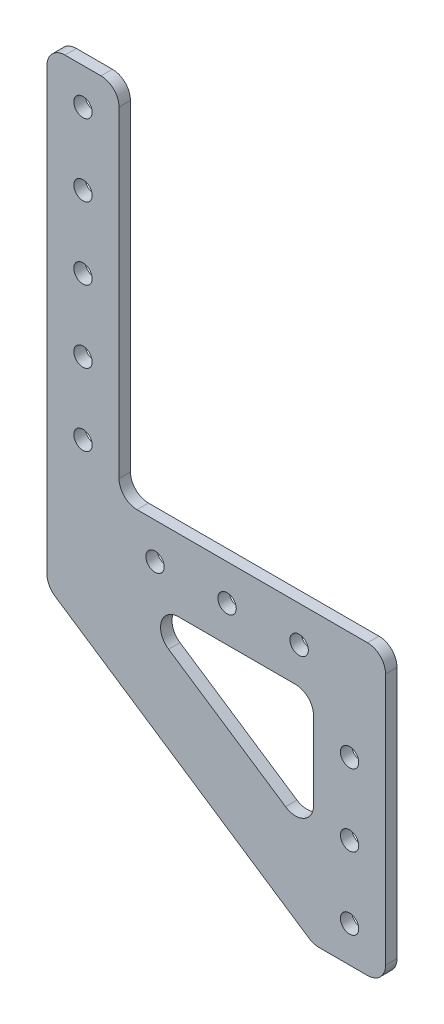
from build123d import *

# Parameters (mm, degrees)
SKETCH1_R           = 2.55
BOSS_EXTRUDE1_DEPTH = 1.5875
FILLET1_R           = 5


with BuildPart() as part:
    # Sketch1 → Boss-Extrude1 (new, symmetric)
    with BuildSketch(Plane.XY):
        Polygon((-74, 119.291259303), (-54, 119.291259303), (-54, 20), (20, 20), (20, -60), (0, -60), (-74, -10.708740697), align=None)
        with Locations((-64, 109.291259303)):
            Circle(SKETCH1_R, mode=Mode.SUBTRACT)
        with Locations((-64, 89.291259303)):
            Circle(SKETCH1_R, mode=Mode.SUBTRACT)
        with Locations((10, -50)):
            Circle(SKETCH1_R, mode=Mode.SUBTRACT)
        with Locations((10, -30)):
            Circle(SKETCH1_R, mode=Mode.SUBTRACT)
        with Locations((10, -10)):
            Circle(SKETCH1_R, mode=Mode.SUBTRACT)
        with Locations((-44, 10)):
            Circle(SKETCH1_R, mode=Mode.SUBTRACT)
        with Locations((-24, 10)):
            Circle(SKETCH1_R, mode=Mode.SUBTRACT)
        with Locations((-4, 10)):
            Circle(SKETCH1_R, mode=Mode.SUBTRACT)
        with Locations((-64, 69.291259303)):
            Circle(SKETCH1_R, mode=Mode.SUBTRACT)
        with Locations((-64, 49.291259303)):
            Circle(SKETCH1_R, mode=Mode.SUBTRACT)
        with Locations((-64, 29.291259303)):
            Circle(SKETCH1_R, mode=Mode.SUBTRACT)
        Polygon((0, -35.96929733), (0, 0), (-54, 0), align=None, mode=Mode.SUBTRACT)
    extrude(amount=BOSS_EXTRUDE1_DEPTH, both=True)

    # Fillet1
    fillet1_edges = [part.edges().sort_by_distance(p)[0] for p in [
        (0, -35.96929733, 0),
        (-54, 0, 0),
        (0, 0, 0),
        (-74, -10.708740697, 0),
        (0, -60, 0),
        (20, -60, 0),
        (20, 20, 0),
        (-54, 20, 0),
        (-74, 119.291259303, 0),
        (-54, 119.291259303, 0),
    ]]
    fillet(fillet1_edges, radius=FILLET1_R)


solid = part.part
